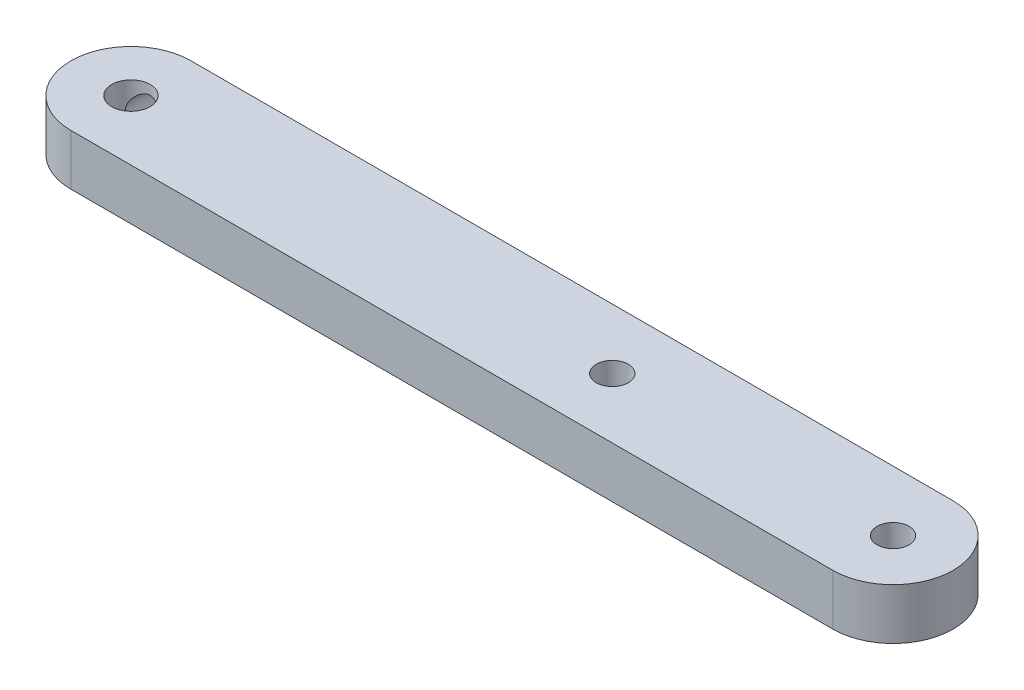
from build123d import *

# Parameters (mm, degrees)
SKETCH1_R           = 2.4
SKETCH1_R_2         = 2
BOSS_EXTRUDE1_DEPTH = 6.35
SKETCH2_R           = 2
CUT_EXTRUDE1_DEPTH  = 10


with BuildPart() as part:
    # Sketch1 → Boss-Extrude1 (new body)
    with BuildSketch(Plane(origin=(0, 0, 0), x_dir=(1, 0, 0), z_dir=(0, 1, 0))):
        with BuildLine():
            Line((0, 7.5), (95, 7.5))
            ThreePointArc((95, 7.5), (102.5, 0), (95, -7.5))
            Line((95, -7.5), (0, -7.5))
            ThreePointArc((0, -7.5), (-7.5, 0), (0, 7.5))
        make_face()
        Circle(SKETCH1_R, mode=Mode.SUBTRACT)
        with Locations((60, 0)):
            Circle(SKETCH1_R_2, mode=Mode.SUBTRACT)
        with Locations((95, 0)):
            Circle(SKETCH1_R_2, mode=Mode.SUBTRACT)
    extrude(amount=BOSS_EXTRUDE1_DEPTH)

    # Sketch2 → Cut-Extrude1 (cut)
    with BuildSketch(Plane.XY):
        with Locations((0, 3.175)):
            Circle(SKETCH2_R)
    extrude(amount=-CUT_EXTRUDE1_DEPTH, mode=Mode.SUBTRACT)


solid = part.part
